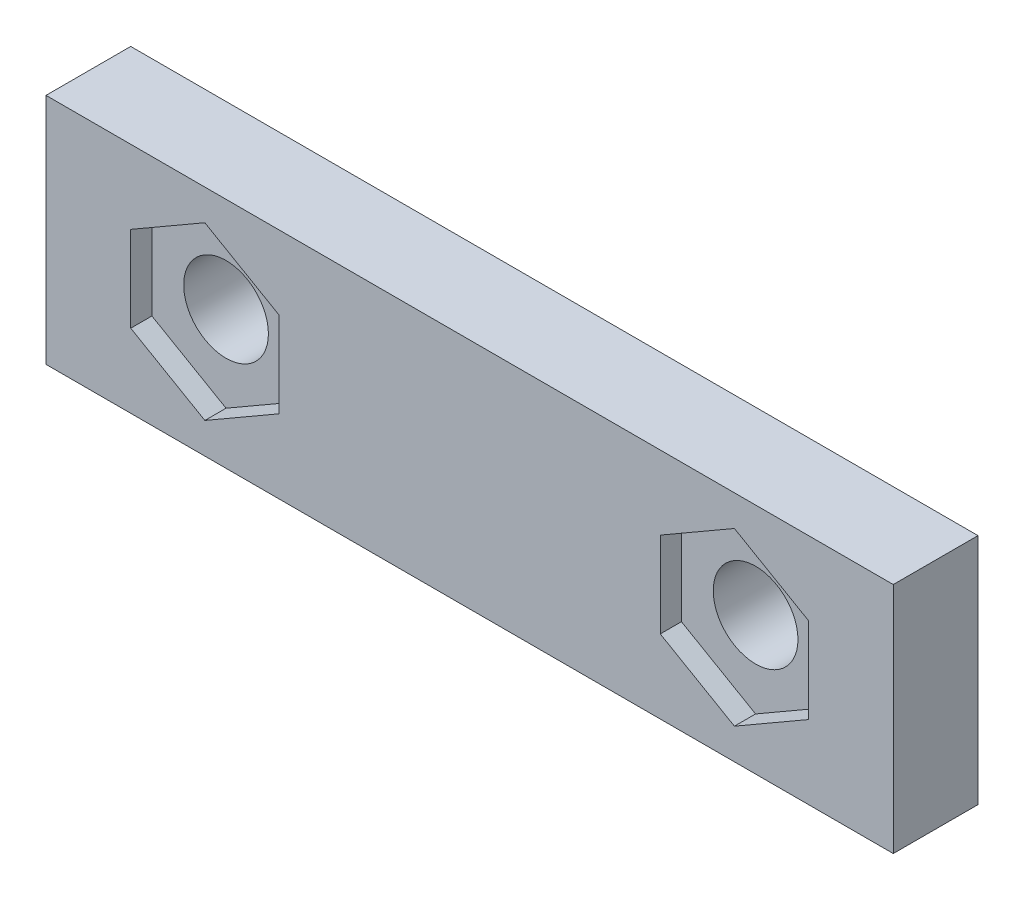
from build123d import *

# Parameters (mm, degrees)
SKETCH1_W           = 40
SKETCH1_H           = 11
SKETCH1_R           = 2
BOSS_EXTRUDE1_DEPTH = 3
SKETCH1_3_W         = 40
SKETCH1_3_H         = 11
BOSS_EXTRUDE2_DEPTH = 4


with BuildPart() as part:
    # Sketch1 → Boss-Extrude1 (new body)
    with BuildSketch(Plane.XY):
        with Locations((214.8, -45)):
            Rectangle(SKETCH1_W, SKETCH1_H)
        with Locations((202.3, -45)):
            Circle(SKETCH1_R, mode=Mode.SUBTRACT)
        with Locations((227.3, -45)):
            Circle(SKETCH1_R, mode=Mode.SUBTRACT)
    extrude(amount=BOSS_EXTRUDE1_DEPTH)

    # Sketch1<3> → Boss-Extrude2 (add)
    with BuildSketch(Plane.XY):
        with Locations((214.8, -45)):
            Rectangle(SKETCH1_3_W, SKETCH1_3_H)
        Polygon((205.8, -47.020725942), (202.3, -49.041451884), (198.8, -47.020725942), (198.8, -42.979274058), (202.3, -40.958548116), (205.8, -42.979274058), align=None, mode=Mode.SUBTRACT)
        Polygon((230.8, -47.020725942), (227.3, -49.041451884), (223.8, -47.020725942), (223.8, -42.979274058), (227.3, -40.958548116), (230.8, -42.979274058), align=None, mode=Mode.SUBTRACT)
    extrude(amount=BOSS_EXTRUDE2_DEPTH)


solid = part.part
